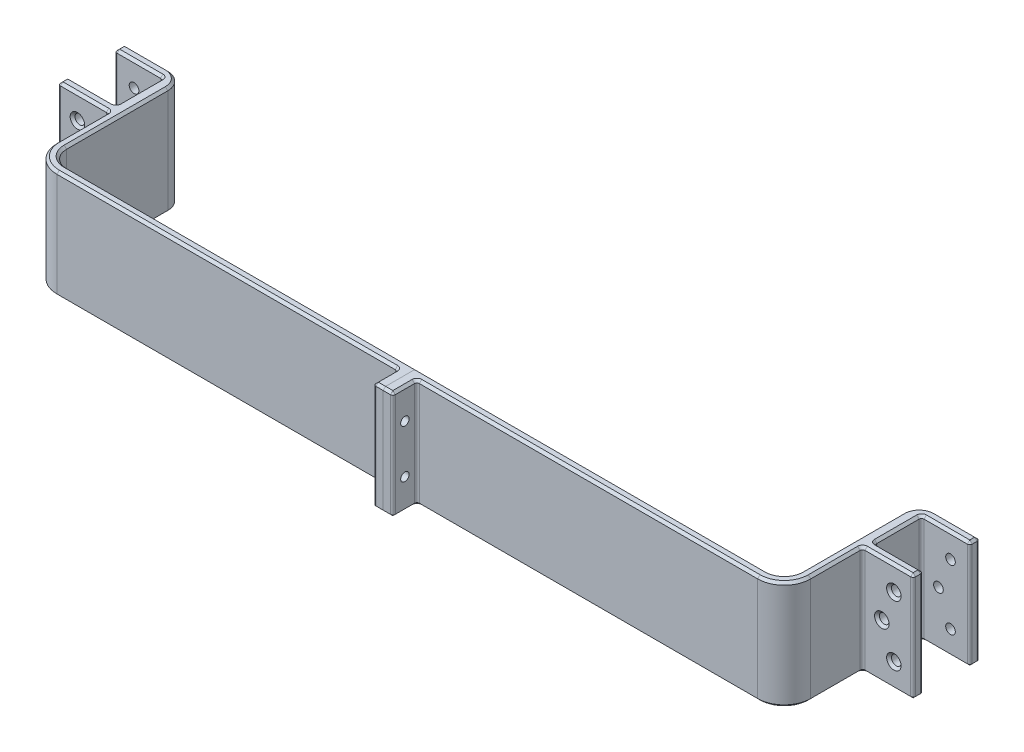
from build123d import *

# Parameters (mm, degrees)
BOSS_EXTRUDE1_DEPTH = 22.5
SKETCH4_R           = 2
CUT_EXTRUDE1_DEPTH  = 184.802230672
SKETCH5_R           = 1.75
CUT_EXTRUDE2_DEPTH  = 184.6023148
FILLET1_R           = 7
FILLET3_R           = 11
FILLET2_R           = 1
CHAMFER1_SIZE       = 1
CHAMFER2_SIZE       = 1


with BuildPart() as part:
    # Sketch1 → Boss-Extrude1 (new, symmetric)
    with BuildSketch(Plane(origin=(0, 0, 0), x_dir=(1, 0, 0), z_dir=(0, 1, 0))):
        Polygon((-152.4, 0), (-152.4, 56), (-177.4, 56), (-177.4, 52), (-157.4, 52), (-157.4, 32.5), (-177.4, 32.5), (-177.4, 28.5), (-156.4, 28.5), (-156.4, -4), (-4, -4), (-4, -14), (0, -14), (0, 0), align=None)
    extrude(amount=BOSS_EXTRUDE1_DEPTH, both=True)

    # Sketch4 → Cut-Extrude1 (cut, through all)
    with BuildSketch(Plane.XY.offset(-28.5)):
        with Locations((-164.4, 0)):
            Circle(SKETCH4_R)
        with Locations((-169.4, 12.5)):
            Circle(SKETCH4_R)
        with Locations((-169.4, -12.5)):
            Circle(SKETCH4_R)
    extrude(amount=-CUT_EXTRUDE1_DEPTH, mode=Mode.SUBTRACT)

    # Sketch5 → Cut-Extrude2 (cut, through all)
    with BuildSketch(Plane.ZY.offset(4)):
        with Locations((9, 10)):
            Circle(SKETCH5_R)
        with Locations((9, -10)):
            Circle(SKETCH5_R)
    extrude(amount=-CUT_EXTRUDE2_DEPTH, mode=Mode.SUBTRACT)

    # Fillet1
    fillet1_edges = [part.edges().sort_by_distance(p)[0] for p in [
        (-152.4, 0, -56),
        (-152.4, 0, 0),
    ]]
    fillet(fillet1_edges, radius=FILLET1_R)

    # Fillet3
    fillet3_edges = [part.edges().sort_by_distance(p)[0] for p in [
        (-156.4, 0, 4),
    ]]
    fillet(fillet3_edges, radius=FILLET3_R)

    # Fillet2
    fillet2_edges = [part.edges().sort_by_distance(p)[0] for p in [
        (-4, 0, 14),
        (-4, 0, 4),
        (-156.4, 0, -28.5),
        (-177.4, 0, -28.5),
        (-177.4, 0, -32.5),
        (-157.4, 0, -32.5),
        (-157.4, 0, -52),
        (-177.4, 0, -52),
        (-177.4, 0, -56),
    ]]
    fillet(fillet2_edges, radius=FILLET2_R)

    # Chamfer1
    chamfer1_edges = [part.edges().sort_by_distance(p)[0] for p in [
        (-156.4, 22.5, -17.25),
        (-156.692893219, 22.5, -28.207106781),
        (-166.9, 22.5, -28.5),
        (-177.107106781, 22.5, -28.792893219),
        (-177.4, 22.5, -30.5),
        (-177.107106781, 22.5, -32.207106781),
        (-167.4, 22.5, -32.5),
        (-157.692893219, 22.5, -32.792893219),
        (-157.4, 22.5, -42.25),
        (-157.692893219, 22.5, -51.707106781),
        (-167.4, 22.5, -52),
        (-177.107106781, 22.5, -52.292893219),
        (-152.4, 22.5, -28),
        (-177.4, 22.5, -54),
        (-154.450252532, 22.5, -53.949747468),
        (-177.107106781, 22.5, -55.707106781),
        (-167.9, 22.5, -56),
        (-72.7, 22.5, 0),
        (-150.349747468, 22.5, -2.050252532),
        (-75.2, 22.5, 4),
        (-1.5, 22.5, 14),
        (-3.707106781, 22.5, 13.707106781),
        (-4, 22.5, 9),
        (-4.292893219, 22.5, 4.292893219),
        (-153.178174593, 22.5, 0.778174593),
        (-72.7, -22.5, 0),
        (-150.349747468, -22.5, -2.050252532),
        (-152.4, -22.5, -28),
        (-154.450252532, -22.5, -53.949747468),
        (-167.9, -22.5, -56),
        (-177.107106781, -22.5, -55.707106781),
        (-177.4, -22.5, -54),
        (-177.107106781, -22.5, -52.292893219),
        (-167.4, -22.5, -52),
        (-157.692893219, -22.5, -51.707106781),
        (-157.4, -22.5, -42.25),
        (-157.692893219, -22.5, -32.792893219),
        (-167.4, -22.5, -32.5),
        (-177.107106781, -22.5, -32.207106781),
        (-177.4, -22.5, -30.5),
        (-177.107106781, -22.5, -28.792893219),
        (-166.9, -22.5, -28.5),
        (-1.5, -22.5, 14),
        (-156.692893219, -22.5, -28.207106781),
        (-3.707106781, -22.5, 13.707106781),
        (-156.4, -22.5, -17.25),
        (-4, -22.5, 9),
        (-153.178174593, -22.5, 0.778174593),
        (-4.292893219, -22.5, 4.292893219),
        (-75.2, -22.5, 4),
    ]]
    chamfer(chamfer1_edges, length=CHAMFER1_SIZE - 0.0001)  # a hair under: the kernel refuses the full size

    # Chamfer2
    chamfer2_edges = [part.edges().sort_by_distance(p)[0] for p in [
        (-166.4, 0, -56),
        (-166.4, 0, -28.5),
        (-171.4, 12.5, -56),
        (-171.4, 12.5, -28.5),
        (-171.4, -12.5, -56),
        (-171.4, -12.5, -28.5),
    ]]
    chamfer(chamfer2_edges, length=CHAMFER2_SIZE)


with BuildPart() as body_2:
    # Mirror1: mirrored copy
    add(part.part.mirror(Plane(origin=(0, 22.5, 14), x_dir=(0, 0, 1), z_dir=(-1, 0, 0))))


solid = Compound([part.part, body_2.part])
